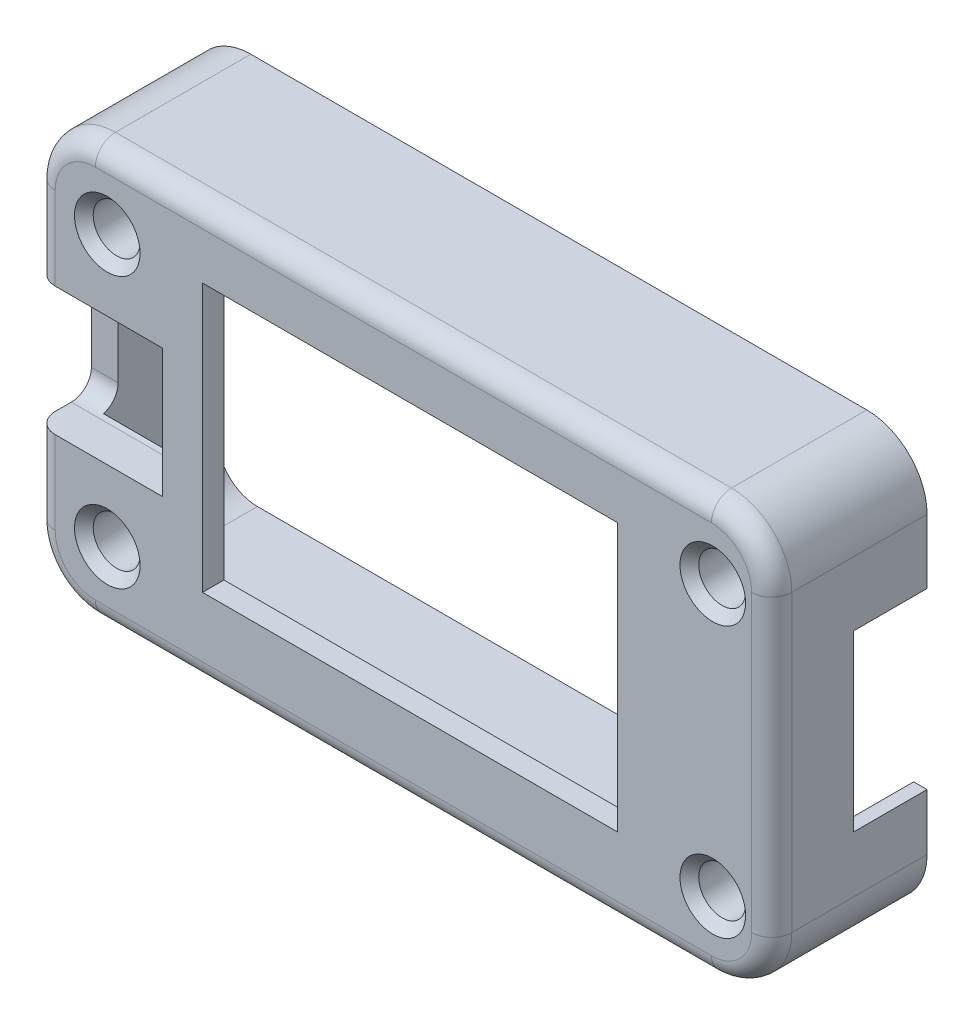
from build123d import *

# Parameters (mm, degrees)
SKETCH_1_W          = 55
SKETCH_1_H          = 31
SKETCH_1_W_2        = 52
SKETCH_1_H_2        = 27
EXTRUDE_1_DEPTH     = 10
SKETCH_2_W          = 55
SKETCH_2_H          = 31
EXTRUDE_2_DEPTH     = 1.6
CUT_EXTRUDE_1_REACH = 66.192
SKETCH_3_W          = 31
SKETCH_3_H          = 20
SKETCH_4_W          = 52
SKETCH_4_H          = 27
SKETCH_4_W_2        = 35
SKETCH_4_H_2        = 24
EXTRUDE_3_DEPTH     = 1.5
SKETCH_5_W          = 15
SKETCH_5_H          = 2
CUT_EXTRUDE_2_DEPTH = 1.5
SKETCH_7_W          = 9.5
SKETCH_7_H          = 9.6
CUT_EXTRUDE_4_DEPTH = 4.2
SKETCH_8_W          = 1
SKETCH_8_H          = 9.6
CUT_EXTRUDE_5_DEPTH = 1.5
SKETCH_9_W          = 1
SKETCH_9_H          = 13
CUT_EXTRUDE_6_DEPTH = 5.5
SKETCH_10_R         = 1.75
CUT_EXTRUDE_7_DEPTH = 64.704395453
FILLET_1_R          = 3
FILLET_2_R          = 4.5
FILLET_3_R          = 1.5
FILLET_4_R          = 1.5
CHAMFER_1_SIZE      = 0.7


with BuildPart() as part:
    # 草图1 → 凸台-拉伸1 (new body)
    with BuildSketch(Plane.XY):
        with Locations((27.5, -15.5)):
            Rectangle(SKETCH_1_W, SKETCH_1_H)
        with Locations((28, -15.5)):
            Rectangle(SKETCH_1_W_2, SKETCH_1_H_2, mode=Mode.SUBTRACT)
    extrude(amount=EXTRUDE_1_DEPTH)

    # 草图2 → 凸台-拉伸2 (add)
    with BuildSketch(Plane.XY.offset(10)):
        with Locations((27.5, -15.5)):
            Rectangle(SKETCH_2_W, SKETCH_2_H)
    extrude(amount=EXTRUDE_2_DEPTH)

    # 草图3 → 切除-拉伸1 (cut, up to next)
    with BuildSketch(Plane.XY.offset(11.6), mode=Mode.PRIVATE) as cut_extrude_1_sk1:
        with Locations((28, -15)):
            Rectangle(SKETCH_3_W, SKETCH_3_H)
    cut_extrude_1_tool1 = extrude(cut_extrude_1_sk1.sketch, amount=-CUT_EXTRUDE_1_REACH, mode=Mode.PRIVATE) & part.part
    add(cut_extrude_1_tool1.solids().sort_by_distance((28, -15, 11.6))[0], mode=Mode.SUBTRACT)

    # 草图4 → 凸台-拉伸3 (add)
    with BuildSketch(Plane(origin=(0, 0, 10), x_dir=(-1, 0, 0), z_dir=(0, 0, -1))):
        with Locations((-28, -15.5)):
            Rectangle(SKETCH_4_W, SKETCH_4_H)
        with Locations((-28, -15)):
            Rectangle(SKETCH_4_W_2, SKETCH_4_H_2, mode=Mode.SUBTRACT)
    extrude(amount=EXTRUDE_3_DEPTH)

    # 草图5 → 切除-拉伸2 (cut)
    with BuildSketch(Plane(origin=(0, 0, 8.5), x_dir=(-1, 0, 0), z_dir=(0, 0, -1))):
        with Locations((-28, -28)):
            Rectangle(SKETCH_5_W, SKETCH_5_H)
    extrude(amount=-CUT_EXTRUDE_2_DEPTH, mode=Mode.SUBTRACT)

    # 草图7 → 切除-拉伸4 (cut)
    with BuildSketch(Plane.XY.offset(11.6)):
        with Locations((4.75, -15.5)):
            Rectangle(SKETCH_7_W, SKETCH_7_H)
    extrude(amount=-CUT_EXTRUDE_4_DEPTH, mode=Mode.SUBTRACT)

    # 草图8 → 切除-拉伸5 (cut)
    with BuildSketch(Plane(origin=(0, 0, 8.5), x_dir=(-1, 0, 0), z_dir=(0, 0, -1))):
        with Locations((-10, -15.5)):
            Rectangle(SKETCH_8_W, SKETCH_8_H)
    extrude(amount=-CUT_EXTRUDE_5_DEPTH, mode=Mode.SUBTRACT)

    # 草图9 → 切除-拉伸6 (cut)
    with BuildSketch(Plane(origin=(0, 0, 0), x_dir=(-1, 0, 0), z_dir=(0, 0, -1))):
        with Locations((-54.5, -15.8)):
            Rectangle(SKETCH_9_W, SKETCH_9_H)
    extrude(amount=-CUT_EXTRUDE_6_DEPTH, mode=Mode.SUBTRACT)

    # 草图10 → 切除-拉伸7 (cut, through all)
    with BuildSketch(Plane(origin=(0, 0, 8.5), x_dir=(-1, 0, 0), z_dir=(0, 0, -1))):
        with Locations((-50.6, -5.4)):
            Circle(SKETCH_10_R)
        with Locations((-5.388, -5.4)):
            Circle(SKETCH_10_R)
        with Locations((-5.388, -25.6)):
            Circle(SKETCH_10_R)
        with Locations((-50.6, -25.6)):
            Circle(SKETCH_10_R)
    extrude(amount=-CUT_EXTRUDE_7_DEPTH, mode=Mode.SUBTRACT)

    # 圆角1
    fillet_1_edges = [part.edges().sort_by_distance(p)[0] for p in [
        (2, -29, 4.25),
        (54, -29, 4.25),
        (54, -2, 4.25),
        (2, -2, 4.25),
    ]]
    fillet(fillet_1_edges, radius=FILLET_1_R)

    # 圆角2
    fillet_2_edges = [part.edges().sort_by_distance(p)[0] for p in [
        (0, 0, 5.8),
        (0, -31, 5.8),
        (55, -31, 5.8),
        (55, 0, 5.8),
    ]]
    fillet(fillet_2_edges, radius=FILLET_2_R)

    # 圆角3
    fillet_3_edges = [part.edges().sort_by_distance(p)[0] for p in [
        (1, -20.3, 7.4),
        (1, -10.7, 7.4),
    ]]
    fillet(fillet_3_edges, radius=FILLET_3_R)

    # 圆角4
    fillet_4_edges = [part.edges().sort_by_distance(p)[0] for p in [
        (0, -23.4, 11.6),
        (1.318019485, -29.681980515, 11.6),
        (0, -7.6, 11.6),
        (1.318019485, -1.318019485, 11.6),
        (27.5, 0, 11.6),
        (53.681980515, -1.318019485, 11.6),
        (55, -15.5, 11.6),
        (53.681980515, -29.681980515, 11.6),
        (27.5, -31, 11.6),
    ]]
    fillet(fillet_4_edges, radius=FILLET_4_R)

    # 倒角1
    chamfer_1_edges = [part.edges().sort_by_distance(p)[0] for p in [
        (7.138, -5.4, 11.6),
        (7.138, -25.6, 11.6),
        (52.35, -5.4, 11.6),
        (52.35, -25.6, 11.6),
    ]]
    chamfer(chamfer_1_edges, length=CHAMFER_1_SIZE)


solid = part.part
